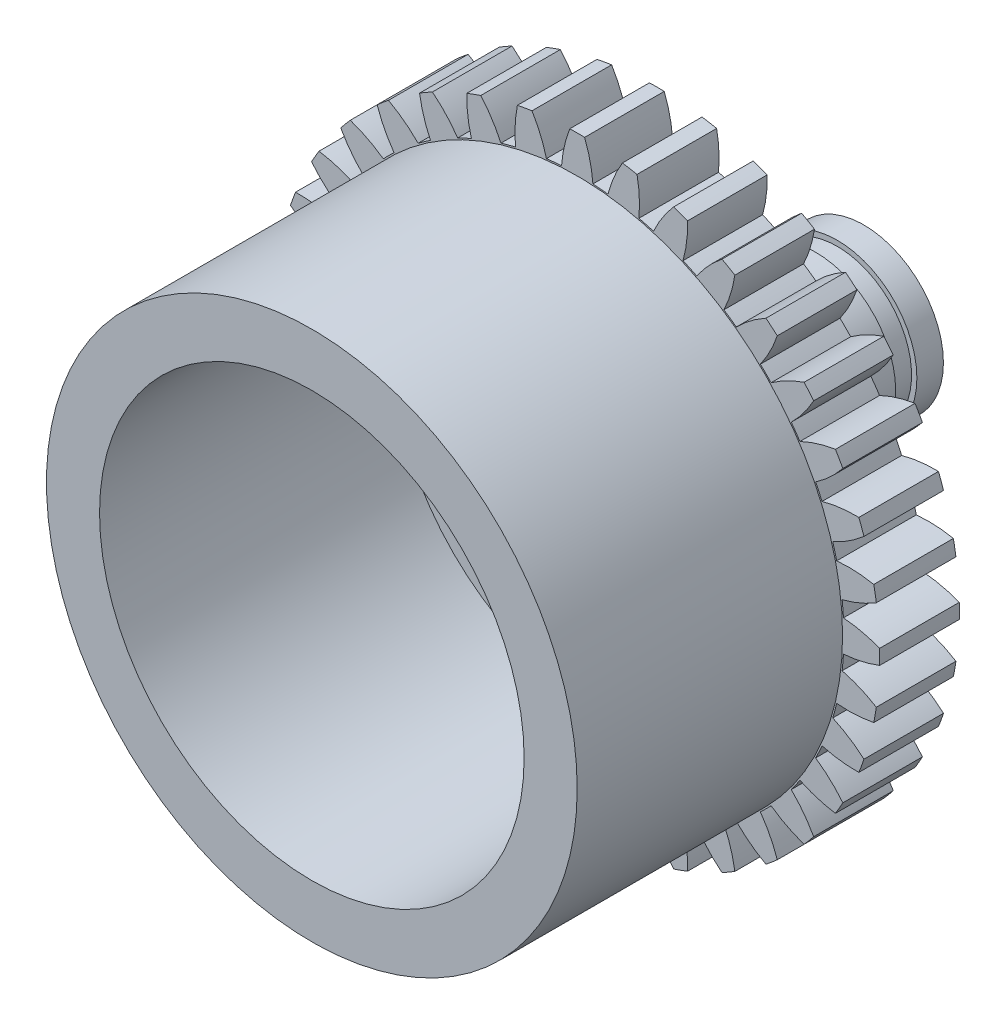
from build123d import *

# Parameters (mm, degrees)
SKETCH_1_R          = 5
EXTRUDE_1_DEPTH     = 5
SKETCH_2_R          = 1.5
EXTRUDE_2_DEPTH     = 5.4
SKETCH_3_R          = 2
EXTRUDE_3_DEPTH     = 2
SKETCH_4_R          = 0.79
CUT_EXTRUDE_1_DEPTH = 2
EXTRUDE_4_DEPTH     = 1.5
SKETCH_6_R          = 4
CUT_EXTRUDE_2_DEPTH = 5.5
CUT_EXTRUDE_START   = 3
SKETCH_7_R          = 2
SKETCH_7_R_2        = 1.4
CUT_EXTRUDE_3_DEPTH = 0.4


with BuildPart() as part:
    # 스케치1 → 보스-돌출1 (new body)
    with BuildSketch(Plane.XY):
        Circle(SKETCH_1_R)
    extrude(amount=EXTRUDE_1_DEPTH)

    # 스케치2 → 보스-돌출2 (add)
    with BuildSketch(Plane(origin=(0, 0, 0), x_dir=(-1, 0, 0), z_dir=(0, 0, -1))):
        Circle(SKETCH_2_R)
    extrude(amount=EXTRUDE_2_DEPTH)

    # 스케치3 → 보스-돌출3 (add)
    with BuildSketch(Plane(origin=(0, 0, 0), x_dir=(-1, 0, 0), z_dir=(0, 0, -1))):
        Circle(SKETCH_3_R)
    extrude(amount=EXTRUDE_3_DEPTH)

    # 스케치4 → 컷-돌출1 (cut)
    with BuildSketch(Plane(origin=(0, 0, -5.4), x_dir=(-1, 0, 0), z_dir=(0, 0, -1))):
        Circle(SKETCH_4_R)
    extrude(amount=-CUT_EXTRUDE_1_DEPTH, mode=Mode.SUBTRACT)

    # 스케치5 → 보스-돌출4 (add)
    with BuildSketch(Plane(origin=(0, 0, 0), x_dir=(-1, 0, 0), z_dir=(0, 0, -1))):
        with BuildLine():
            ThreePointArc((-0.295754882, 5.016288872), (-0.243045211, 5.363052817), (-0.139875757, 5.698283494))
            ThreePointArc((-0.139875757, 5.698283494), (0, 5.7), (0.139875757, 5.698283494))
            ThreePointArc((0.139875757, 5.698283494), (0.243045211, 5.363052817), (0.295754882, 5.016288872))
            ThreePointArc((0.295754882, 5.016288872), (0.437957607, 5.005878358), (0.57980772, 4.991437469))
            ThreePointArc((0.57980772, 4.991437469), (0.69193154, 5.323780352), (0.851745815, 5.636002934))
            ThreePointArc((0.851745815, 5.636002934), (0.989794613, 5.613404192), (1.127247274, 5.587424593))
            ThreePointArc((1.127247274, 5.587424593), (1.170637157, 5.239371636), (1.162331123, 4.888722876))
            ThreePointArc((1.162331123, 4.888722876), (1.300565702, 4.853777277), (1.437753158, 4.814923764))
            ThreePointArc((1.437753158, 4.814923764), (1.605884302, 5.122747515), (1.817487521, 5.402475276))
            ThreePointArc((1.817487521, 5.402475276), (1.949514817, 5.356247938), (2.080367954, 5.306794624))
            ThreePointArc((2.080367954, 5.306794624), (2.062659884, 4.956494799), (1.99359052, 4.61261551))
            ThreePointArc((1.99359052, 4.61261551), (2.123656765, 4.55419663), (2.252013195, 4.492111037))
            ThreePointArc((2.252013195, 4.492111037), (2.471043081, 4.766062587), (2.728005788, 5.004796142))
            ThreePointArc((2.728005788, 5.004796142), (2.85, 4.936344802), (2.970277706, 4.864920385))
            ThreePointArc((2.970277706, 4.864920385), (2.892009736, 4.523017376), (2.764275678, 4.196356155))
            ThreePointArc((2.764275678, 4.196356155), (2.882221593, 4.116239023), (2.997846949, 4.03280779))
            ThreePointArc((2.997846949, 4.03280779), (3.261120467, 4.264563259), (3.55563498, 4.455048809))
            ThreePointArc((3.55563498, 4.455048809), (3.663889375, 4.366453326), (3.769937072, 4.275228002))
            ThreePointArc((3.769937072, 4.275228002), (3.633487334, 3.952110358), (3.450969718, 3.652592642))
            ThreePointArc((3.450969718, 3.652592642), (3.553211575, 3.553211575), (3.652592642, 3.450969718))
            ThreePointArc((3.652592642, 3.450969718), (3.952110358, 3.633487334), (4.275228002, 3.769937072))
            ThreePointArc((4.275228002, 3.769937072), (4.366453326, 3.663889375), (4.455048809, 3.55563498))
            ThreePointArc((4.455048809, 3.55563498), (4.264563259, 3.261120467), (4.03280779, 2.997846949))
            ThreePointArc((4.03280779, 2.997846949), (4.116239023, 2.882221593), (4.196356155, 2.764275678))
            ThreePointArc((4.196356155, 2.764275678), (4.523017376, 2.892009736), (4.864920385, 2.970277706))
            ThreePointArc((4.864920385, 2.970277706), (4.936344802, 2.85), (5.004796142, 2.728005788))
            ThreePointArc((5.004796142, 2.728005788), (4.766062587, 2.471043081), (4.492111037, 2.252013195))
            ThreePointArc((4.492111037, 2.252013195), (4.55419663, 2.123656765), (4.61261551, 1.99359052))
            ThreePointArc((4.61261551, 1.99359052), (4.956494799, 2.062659884), (5.306794624, 2.080367954))
            ThreePointArc((5.306794624, 2.080367954), (5.356247938, 1.949514817), (5.402475276, 1.817487521))
            ThreePointArc((5.402475276, 1.817487521), (5.122747515, 1.605884302), (4.814923764, 1.437753158))
            ThreePointArc((4.814923764, 1.437753158), (4.853777277, 1.300565702), (4.888722876, 1.162331123))
            ThreePointArc((4.888722876, 1.162331123), (5.239371636, 1.170637157), (5.587424593, 1.127247274))
            ThreePointArc((5.587424593, 1.127247274), (5.613404192, 0.989794613), (5.636002934, 0.851745815))
            ThreePointArc((5.636002934, 0.851745815), (5.323780352, 0.69193154), (4.991437469, 0.57980772))
            ThreePointArc((4.991437469, 0.57980772), (5.005878358, 0.437957607), (5.016288872, 0.295754882))
            ThreePointArc((5.016288872, 0.295754882), (5.363052817, 0.243045211), (5.698283494, 0.139875757))
            ThreePointArc((5.698283494, 0.139875757), (5.7, 0), (5.698283494, -0.139875757))
            ThreePointArc((5.698283494, -0.139875757), (5.363052817, -0.243045211), (5.016288872, -0.295754882))
            ThreePointArc((5.016288872, -0.295754882), (5.005878358, -0.437957607), (4.991437469, -0.57980772))
            ThreePointArc((4.991437469, -0.57980772), (5.323780352, -0.69193154), (5.636002934, -0.851745815))
            ThreePointArc((5.636002934, -0.851745815), (5.613404192, -0.989794613), (5.587424593, -1.127247274))
            ThreePointArc((5.587424593, -1.127247274), (5.239371636, -1.170637157), (4.888722876, -1.162331123))
            ThreePointArc((4.888722876, -1.162331123), (4.853777277, -1.300565702), (4.814923764, -1.437753158))
            ThreePointArc((4.814923764, -1.437753158), (5.122747515, -1.605884302), (5.402475276, -1.817487521))
            ThreePointArc((5.402475276, -1.817487521), (5.356247938, -1.949514817), (5.306794624, -2.080367954))
            ThreePointArc((5.306794624, -2.080367954), (4.956494799, -2.062659884), (4.61261551, -1.99359052))
            ThreePointArc((4.61261551, -1.99359052), (4.55419663, -2.123656765), (4.492111037, -2.252013195))
            ThreePointArc((4.492111037, -2.252013195), (4.766062587, -2.471043081), (5.004796142, -2.728005788))
            ThreePointArc((5.004796142, -2.728005788), (4.936344802, -2.85), (4.864920385, -2.970277706))
            ThreePointArc((4.864920385, -2.970277706), (4.523017376, -2.892009736), (4.196356155, -2.764275678))
            ThreePointArc((4.196356155, -2.764275678), (4.116239023, -2.882221593), (4.03280779, -2.997846949))
            ThreePointArc((4.03280779, -2.997846949), (4.264563259, -3.261120467), (4.455048809, -3.55563498))
            ThreePointArc((4.455048809, -3.55563498), (4.366453326, -3.663889375), (4.275228002, -3.769937072))
            ThreePointArc((4.275228002, -3.769937072), (3.952110358, -3.633487334), (3.652592642, -3.450969718))
            ThreePointArc((3.652592642, -3.450969718), (3.553211575, -3.553211575), (3.450969718, -3.652592642))
            ThreePointArc((3.450969718, -3.652592642), (3.633487334, -3.952110358), (3.769937072, -4.275228002))
            ThreePointArc((3.769937072, -4.275228002), (3.663889375, -4.366453326), (3.55563498, -4.455048809))
            ThreePointArc((3.55563498, -4.455048809), (3.261120467, -4.264563259), (2.997846949, -4.03280779))
            ThreePointArc((2.997846949, -4.03280779), (2.882221593, -4.116239023), (2.764275678, -4.196356155))
            ThreePointArc((2.764275678, -4.196356155), (2.892009736, -4.523017376), (2.970277706, -4.864920385))
            ThreePointArc((2.970277706, -4.864920385), (2.85, -4.936344802), (2.728005788, -5.004796142))
            ThreePointArc((2.728005788, -5.004796142), (2.471043081, -4.766062587), (2.252013195, -4.492111037))
            ThreePointArc((2.252013195, -4.492111037), (2.123656765, -4.55419663), (1.99359052, -4.61261551))
            ThreePointArc((1.99359052, -4.61261551), (2.062659884, -4.956494799), (2.080367954, -5.306794624))
            ThreePointArc((2.080367954, -5.306794624), (1.949514817, -5.356247938), (1.817487521, -5.402475276))
            ThreePointArc((1.817487521, -5.402475276), (1.605884302, -5.122747515), (1.437753158, -4.814923764))
            ThreePointArc((1.437753158, -4.814923764), (1.300565702, -4.853777277), (1.162331123, -4.888722876))
            ThreePointArc((1.162331123, -4.888722876), (1.170637157, -5.239371636), (1.127247274, -5.587424593))
            ThreePointArc((1.127247274, -5.587424593), (0.989794613, -5.613404192), (0.851745815, -5.636002934))
            ThreePointArc((0.851745815, -5.636002934), (0.69193154, -5.323780352), (0.57980772, -4.991437469))
            ThreePointArc((0.57980772, -4.991437469), (0.437957607, -5.005878358), (0.295754882, -5.016288872))
            ThreePointArc((0.295754882, -5.016288872), (0.243045211, -5.363052817), (0.139875757, -5.698283494))
            ThreePointArc((0.139875757, -5.698283494), (0, -5.7), (-0.139875757, -5.698283494))
            ThreePointArc((-0.139875757, -5.698283494), (-0.243045211, -5.363052817), (-0.295754882, -5.016288872))
            ThreePointArc((-0.295754882, -5.016288872), (-0.437957607, -5.005878358), (-0.57980772, -4.991437469))
            ThreePointArc((-0.57980772, -4.991437469), (-0.69193154, -5.323780352), (-0.851745815, -5.636002934))
            ThreePointArc((-0.851745815, -5.636002934), (-0.989794613, -5.613404192), (-1.127247274, -5.587424593))
            ThreePointArc((-1.127247274, -5.587424593), (-1.170637157, -5.239371636), (-1.162331123, -4.888722876))
            ThreePointArc((-1.162331123, -4.888722876), (-1.300565702, -4.853777277), (-1.437753158, -4.814923764))
            ThreePointArc((-1.437753158, -4.814923764), (-1.605884302, -5.122747515), (-1.817487521, -5.402475276))
            ThreePointArc((-1.817487521, -5.402475276), (-1.949514817, -5.356247938), (-2.080367954, -5.306794624))
            ThreePointArc((-2.080367954, -5.306794624), (-2.062659884, -4.956494799), (-1.99359052, -4.61261551))
            ThreePointArc((-1.99359052, -4.61261551), (-2.123656765, -4.55419663), (-2.252013195, -4.492111037))
            ThreePointArc((-2.252013195, -4.492111037), (-2.471043081, -4.766062587), (-2.728005788, -5.004796142))
            ThreePointArc((-2.728005788, -5.004796142), (-2.85, -4.936344802), (-2.970277706, -4.864920385))
            ThreePointArc((-2.970277706, -4.864920385), (-2.892009736, -4.523017376), (-2.764275678, -4.196356155))
            ThreePointArc((-2.764275678, -4.196356155), (-2.882221593, -4.116239023), (-2.997846949, -4.03280779))
            ThreePointArc((-2.997846949, -4.03280779), (-3.261120467, -4.264563259), (-3.55563498, -4.455048809))
            ThreePointArc((-3.55563498, -4.455048809), (-3.663889375, -4.366453326), (-3.769937072, -4.275228002))
            ThreePointArc((-3.769937072, -4.275228002), (-3.633487334, -3.952110358), (-3.450969718, -3.652592642))
            ThreePointArc((-3.450969718, -3.652592642), (-3.553211575, -3.553211575), (-3.652592642, -3.450969718))
            ThreePointArc((-3.652592642, -3.450969718), (-3.952110358, -3.633487334), (-4.275228002, -3.769937072))
            ThreePointArc((-4.275228002, -3.769937072), (-4.366453326, -3.663889375), (-4.455048809, -3.55563498))
            ThreePointArc((-4.455048809, -3.55563498), (-4.264563259, -3.261120467), (-4.03280779, -2.997846949))
            ThreePointArc((-4.03280779, -2.997846949), (-4.116239023, -2.882221593), (-4.196356155, -2.764275678))
            ThreePointArc((-4.196356155, -2.764275678), (-4.523017376, -2.892009736), (-4.864920385, -2.970277706))
            ThreePointArc((-4.864920385, -2.970277706), (-4.936344802, -2.85), (-5.004796142, -2.728005788))
            ThreePointArc((-5.004796142, -2.728005788), (-4.766062587, -2.471043081), (-4.492111037, -2.252013195))
            ThreePointArc((-4.492111037, -2.252013195), (-4.55419663, -2.123656765), (-4.61261551, -1.99359052))
            ThreePointArc((-4.61261551, -1.99359052), (-4.956494799, -2.062659884), (-5.306794624, -2.080367954))
            ThreePointArc((-5.306794624, -2.080367954), (-5.356247938, -1.949514817), (-5.402475276, -1.817487521))
            ThreePointArc((-5.402475276, -1.817487521), (-5.122747515, -1.605884302), (-4.814923764, -1.437753158))
            ThreePointArc((-4.814923764, -1.437753158), (-4.853777277, -1.300565702), (-4.888722876, -1.162331123))
            ThreePointArc((-4.888722876, -1.162331123), (-5.239371636, -1.170637157), (-5.587424593, -1.127247274))
            ThreePointArc((-5.587424593, -1.127247274), (-5.613404192, -0.989794613), (-5.636002934, -0.851745815))
            ThreePointArc((-5.636002934, -0.851745815), (-5.323780352, -0.69193154), (-4.991437469, -0.57980772))
            ThreePointArc((-4.991437469, -0.57980772), (-5.005878358, -0.437957607), (-5.016288872, -0.295754882))
            ThreePointArc((-5.016288872, -0.295754882), (-5.363052817, -0.243045211), (-5.698283494, -0.139875757))
            ThreePointArc((-5.698283494, -0.139875757), (-5.7, 0), (-5.698283494, 0.139875757))
            ThreePointArc((-5.698283494, 0.139875757), (-5.363052817, 0.243045211), (-5.016288872, 0.295754882))
            ThreePointArc((-5.016288872, 0.295754882), (-5.005878358, 0.437957607), (-4.991437469, 0.57980772))
            ThreePointArc((-4.991437469, 0.57980772), (-5.323780352, 0.69193154), (-5.636002934, 0.851745815))
            ThreePointArc((-5.636002934, 0.851745815), (-5.613404192, 0.989794613), (-5.587424593, 1.127247274))
            ThreePointArc((-5.587424593, 1.127247274), (-5.239371636, 1.170637157), (-4.888722876, 1.162331123))
            ThreePointArc((-4.888722876, 1.162331123), (-4.853777277, 1.300565702), (-4.814923764, 1.437753158))
            ThreePointArc((-4.814923764, 1.437753158), (-5.122747515, 1.605884302), (-5.402475276, 1.817487521))
            ThreePointArc((-5.402475276, 1.817487521), (-5.356247938, 1.949514817), (-5.306794624, 2.080367954))
            ThreePointArc((-5.306794624, 2.080367954), (-4.956494799, 2.062659884), (-4.61261551, 1.99359052))
            ThreePointArc((-4.61261551, 1.99359052), (-4.55419663, 2.123656765), (-4.492111037, 2.252013195))
            ThreePointArc((-4.492111037, 2.252013195), (-4.766062587, 2.471043081), (-5.004796142, 2.728005788))
            ThreePointArc((-5.004796142, 2.728005788), (-4.936344802, 2.85), (-4.864920385, 2.970277706))
            ThreePointArc((-4.864920385, 2.970277706), (-4.523017376, 2.892009736), (-4.196356155, 2.764275678))
            ThreePointArc((-4.196356155, 2.764275678), (-4.116239023, 2.882221593), (-4.03280779, 2.997846949))
            ThreePointArc((-4.03280779, 2.997846949), (-4.264563259, 3.261120467), (-4.455048809, 3.55563498))
            ThreePointArc((-4.455048809, 3.55563498), (-4.366453326, 3.663889375), (-4.275228002, 3.769937072))
            ThreePointArc((-4.275228002, 3.769937072), (-3.952110358, 3.633487334), (-3.652592642, 3.450969718))
            ThreePointArc((-3.652592642, 3.450969718), (-3.553211575, 3.553211575), (-3.450969718, 3.652592642))
            ThreePointArc((-3.450969718, 3.652592642), (-3.633487334, 3.952110358), (-3.769937072, 4.275228002))
            ThreePointArc((-3.769937072, 4.275228002), (-3.663889375, 4.366453326), (-3.55563498, 4.455048809))
            ThreePointArc((-3.55563498, 4.455048809), (-3.261120467, 4.264563259), (-2.997846949, 4.03280779))
            ThreePointArc((-2.997846949, 4.03280779), (-2.882221593, 4.116239023), (-2.764275678, 4.196356155))
            ThreePointArc((-2.764275678, 4.196356155), (-2.892009736, 4.523017376), (-2.970277706, 4.864920385))
            ThreePointArc((-2.970277706, 4.864920385), (-2.85, 4.936344802), (-2.728005788, 5.004796142))
            ThreePointArc((-2.728005788, 5.004796142), (-2.471043081, 4.766062587), (-2.252013195, 4.492111037))
            ThreePointArc((-2.252013195, 4.492111037), (-2.123656765, 4.55419663), (-1.99359052, 4.61261551))
            ThreePointArc((-1.99359052, 4.61261551), (-2.062659884, 4.956494799), (-2.080367954, 5.306794624))
            ThreePointArc((-2.080367954, 5.306794624), (-1.949514817, 5.356247938), (-1.817487521, 5.402475276))
            ThreePointArc((-1.817487521, 5.402475276), (-1.605884302, 5.122747515), (-1.437753158, 4.814923764))
            ThreePointArc((-1.437753158, 4.814923764), (-1.300565702, 4.853777277), (-1.162331123, 4.888722876))
            ThreePointArc((-1.162331123, 4.888722876), (-1.170637157, 5.239371636), (-1.127247274, 5.587424593))
            ThreePointArc((-1.127247274, 5.587424593), (-0.989794613, 5.613404192), (-0.851745815, 5.636002934))
            ThreePointArc((-0.851745815, 5.636002934), (-0.69193154, 5.323780352), (-0.57980772, 4.991437469))
            ThreePointArc((-0.57980772, 4.991437469), (-0.437957607, 5.005878358), (-0.295754882, 5.016288872))
        make_face()
    extrude(amount=EXTRUDE_4_DEPTH)

    # 스케치6 → 컷-돌출2 (cut)
    with BuildSketch(Plane.XY.offset(5)):
        Circle(SKETCH_6_R)
    extrude(amount=-CUT_EXTRUDE_2_DEPTH, mode=Mode.SUBTRACT)

    # 스케치7 → 컷-돌출3 (cut)
    with BuildSketch(Plane(origin=(0, 0, -1.5), x_dir=(-1, 0, 0), z_dir=(0, 0, -1)).offset(CUT_EXTRUDE_START)):
        Circle(SKETCH_7_R)
        Circle(SKETCH_7_R_2, mode=Mode.SUBTRACT)
    extrude(amount=CUT_EXTRUDE_3_DEPTH, mode=Mode.SUBTRACT)


solid = part.part
